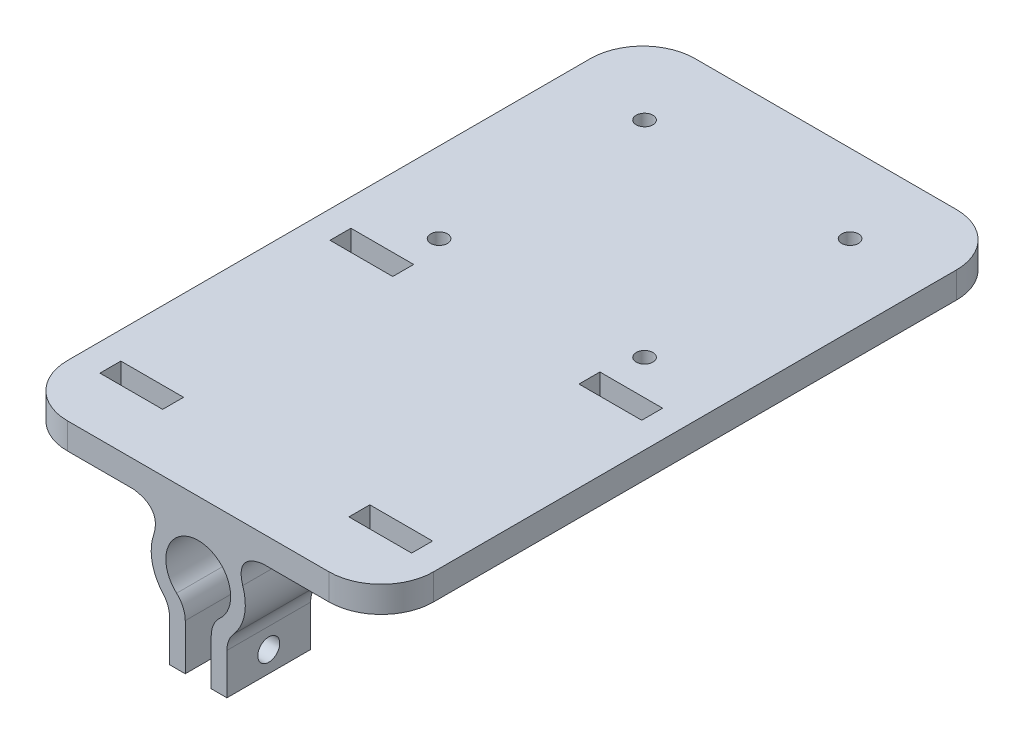
from build123d import *

# Parameters (mm, degrees)
BOSS_EXTRUDE2_START = 10
SKETCH3_W           = 70
SKETCH3_H           = 5
BOSS_EXTRUDE2_DEPTH = 120
BOSS_EXTRUDE3_START = 18
BOSS_EXTRUDE3_DEPTH = 8
SKETCH4_R           = 2.1
CUT_EXTRUDE1_DEPTH  = 11
FILLET1_R           = 10
SKETCH5_R           = 1.6
CUT_EXTRUDE2_DEPTH  = 11
CUT_EXTRUDE6_REACH  = 140.071
SKETCH6_W           = 12
SKETCH6_H           = 4


with BuildPart() as part:
    # Sketch3 → Boss-Extrude2 (new body)
    with BuildSketch(Plane.XY.offset(BOSS_EXTRUDE2_START)):
        with Locations((0, 11)):
            Rectangle(SKETCH3_W, SKETCH3_H)
    extrude(amount=BOSS_EXTRUDE2_DEPTH)

    # Sketch1 → Boss-Extrude3 (add, symmetric)
    with BuildSketch(Plane.XY.offset(BOSS_EXTRUDE3_START)):
        with BuildLine():
            Line((-12.351801858, 8.5), (12.351801858, 8.5))
            add(Edge.make_bspline(
                [(12.351801858, 8.5), (9.979182818, 8.152861079), (7.300358033, 7.013004111), (8.498185188, 2.963249653)],
                knots=[0, 0, 0, 0, 1, 1, 1, 1], degree=3))
            ThreePointArc((8.498185188, 2.963249653), (8.830462519, -1.738658018), (6.740539187, -5.96365085))
            ThreePointArc((6.740539187, -5.96365085), (5.809616385, -7.505310599), (5.48528318, -9.276790212))
            Line((5.48528318, -9.276790212), (5.48528318, -17.135241302))
            Line((5.48528318, -17.135241302), (3.98528318, -17.135241302))
            Line((3.98528318, -17.135241302), (2.48528318, -17.135241302))
            Line((2.48528318, -17.135241302), (2.48528318, -8.331298561))
            ThreePointArc((2.48528318, -8.331298561), (2.918653056, -6.295152862), (4.143638903, -4.611968846))
            ThreePointArc((4.143638903, -4.611968846), (0, 6.2), (-4.143638903, -4.611968846))
            ThreePointArc((-4.143638903, -4.611968846), (-2.918653056, -6.295152862), (-2.48528318, -8.331298561))
            Line((-2.48528318, -8.331298561), (-2.48528318, -17.135241302))
            Line((-2.48528318, -17.135241302), (-3.98528318, -17.135241302))
            Line((-3.98528318, -17.135241302), (-5.48528318, -17.135241302))
            Line((-5.48528318, -17.135241302), (-5.48528318, -9.276790212))
            ThreePointArc((-5.48528318, -9.276790212), (-5.809616385, -7.505310599), (-6.740539187, -5.96365085))
            ThreePointArc((-6.740539187, -5.96365085), (-8.830462519, -1.738658018), (-8.498185188, 2.963249653))
            add(Edge.make_bspline(
                [(-12.351801858, 8.5), (-9.979182818, 8.152861079), (-7.300358033, 7.013004111), (-8.498185188, 2.963249653)],
                knots=[0, 0, 0, 0, 1, 1, 1, 1], degree=3))
        make_face()
    boss_extrude3 = extrude(amount=BOSS_EXTRUDE3_DEPTH, both=True)

    # Sketch4 → Cut-Extrude1 (cut)
    with BuildSketch(Plane.ZY.offset(5.48528318)):
        with Locations((18, -13.137995298)):
            Circle(SKETCH4_R)
    cut_extrude1 = extrude(amount=-CUT_EXTRUDE1_DEPTH, mode=Mode.SUBTRACT)

    # Mirror2: Boss-Extrude3, Cut-Extrude1 across plane
    add(boss_extrude3.mirror(Plane.XY.offset(70)))
    add(cut_extrude1.mirror(Plane.XY.offset(70)), mode=Mode.SUBTRACT)

    # Fillet1
    fillet1_edges = [part.edges().sort_by_distance(p)[0] for p in [
        (35, 11, 10),
        (35, 11, 130),
        (-35, 11, 130),
        (-35, 11, 10),
    ]]
    fillet(fillet1_edges, radius=FILLET1_R)

    # Sketch5 → Cut-Extrude2 (cut)
    with BuildSketch(Plane(origin=(0, 13.5, 0), x_dir=(1, 0, 0), z_dir=(0, 1, 0))):
        with Locations((19.65, -25)):
            Circle(SKETCH5_R)
        with Locations((19.65, -64.3)):
            Circle(SKETCH5_R)
        with Locations((-19.65, -64.3)):
            Circle(SKETCH5_R)
        with Locations((-19.65, -25)):
            Circle(SKETCH5_R)
    extrude(amount=-CUT_EXTRUDE2_DEPTH, mode=Mode.SUBTRACT)

    # Sketch6 → Cut-Extrude6 (cut, up to next)
    with BuildSketch(Plane(origin=(0, 13.5, 0), x_dir=(1, 0, 0), z_dir=(0, 1, 0)), mode=Mode.PRIVATE) as cut_extrude6_sk1:
        with Locations((-23.806344776, -73)):
            Rectangle(SKETCH6_W, SKETCH6_H)
    cut_extrude6_tool1 = extrude(cut_extrude6_sk1.sketch, amount=-CUT_EXTRUDE6_REACH, mode=Mode.PRIVATE) & part.part
    # Sketch6 → Cut-Extrude6 (cut, up to next)
    with BuildSketch(Plane(origin=(0, 13.5, 0), x_dir=(1, 0, 0), z_dir=(0, 1, 0)), mode=Mode.PRIVATE) as cut_extrude6_sk2:
        with Locations((-23.806344776, -117)):
            Rectangle(SKETCH6_W, SKETCH6_H)
    cut_extrude6_tool2 = extrude(cut_extrude6_sk2.sketch, amount=-CUT_EXTRUDE6_REACH, mode=Mode.PRIVATE) & part.part
    # Sketch6 → Cut-Extrude6 (cut, up to next)
    with BuildSketch(Plane(origin=(0, 13.5, 0), x_dir=(1, 0, 0), z_dir=(0, 1, 0)), mode=Mode.PRIVATE) as cut_extrude6_sk3:
        with Locations((23.806344776, -73)):
            Rectangle(SKETCH6_W, SKETCH6_H)
    cut_extrude6_tool3 = extrude(cut_extrude6_sk3.sketch, amount=-CUT_EXTRUDE6_REACH, mode=Mode.PRIVATE) & part.part
    # Sketch6 → Cut-Extrude6 (cut, up to next)
    with BuildSketch(Plane(origin=(0, 13.5, 0), x_dir=(1, 0, 0), z_dir=(0, 1, 0)), mode=Mode.PRIVATE) as cut_extrude6_sk4:
        with Locations((23.806344776, -117)):
            Rectangle(SKETCH6_W, SKETCH6_H)
    cut_extrude6_tool4 = extrude(cut_extrude6_sk4.sketch, amount=-CUT_EXTRUDE6_REACH, mode=Mode.PRIVATE) & part.part
    add(cut_extrude6_tool1.solids().sort_by_distance((-23.806345, 13.5, 73))[0], mode=Mode.SUBTRACT)
    add(cut_extrude6_tool2.solids().sort_by_distance((-23.806345, 13.5, 117))[0], mode=Mode.SUBTRACT)
    add(cut_extrude6_tool3.solids().sort_by_distance((23.806345, 13.5, 73))[0], mode=Mode.SUBTRACT)
    add(cut_extrude6_tool4.solids().sort_by_distance((23.806345, 13.5, 117))[0], mode=Mode.SUBTRACT)


solid = part.part
